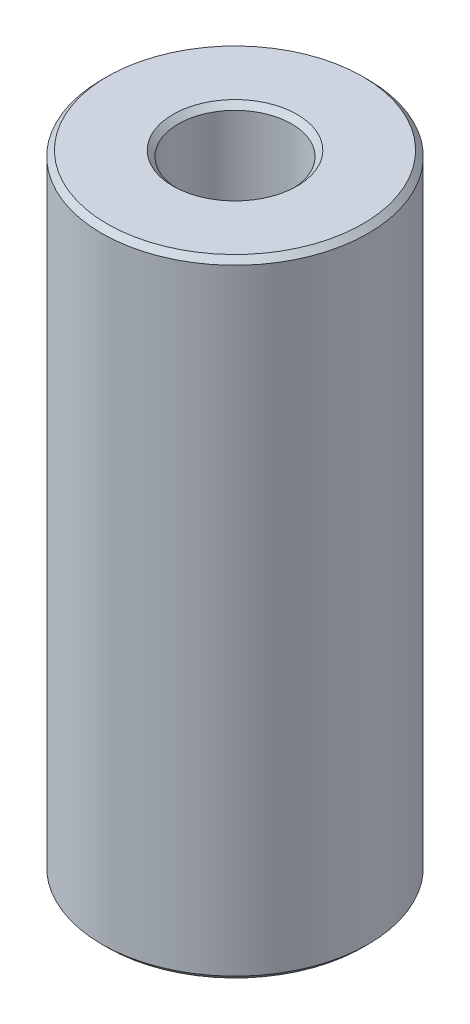
from build123d import *

# Parameters (mm, degrees)
SKETCH1_R           = 47.5
BOSS_EXTRUDE1_DEPTH = 223.475805961
SKETCH2_R           = 20.205926
CUT_EXTRUDE1_DEPTH  = 234.353671173
CHAMFER1_SIZE       = 1.95141698


with BuildPart() as part:
    # Sketch1 → Boss-Extrude1 (new body)
    with BuildSketch(Plane(origin=(0, 0, 0), x_dir=(1, 0, 0), z_dir=(0, 1, 0))):
        Circle(SKETCH1_R)
    extrude(amount=BOSS_EXTRUDE1_DEPTH)

    # Sketch2 → Cut-Extrude1 (cut, through all)
    with BuildSketch(Plane(origin=(0, 0, 0), x_dir=(1, 0, 0), z_dir=(0, 1, 0))):
        Circle(SKETCH2_R)
    extrude(amount=CUT_EXTRUDE1_DEPTH, mode=Mode.SUBTRACT)

    # Chamfer1
    chamfer1_edges = [part.edges().sort_by_distance(p)[0] for p in [
        (-20.205926, 223.475805961, 0),
        (-20.205926, 0, 0),
        (-47.5, 0, 0),
        (-47.5, 223.475805961, 0),
    ]]
    chamfer(chamfer1_edges, length=CHAMFER1_SIZE)


solid = part.part
